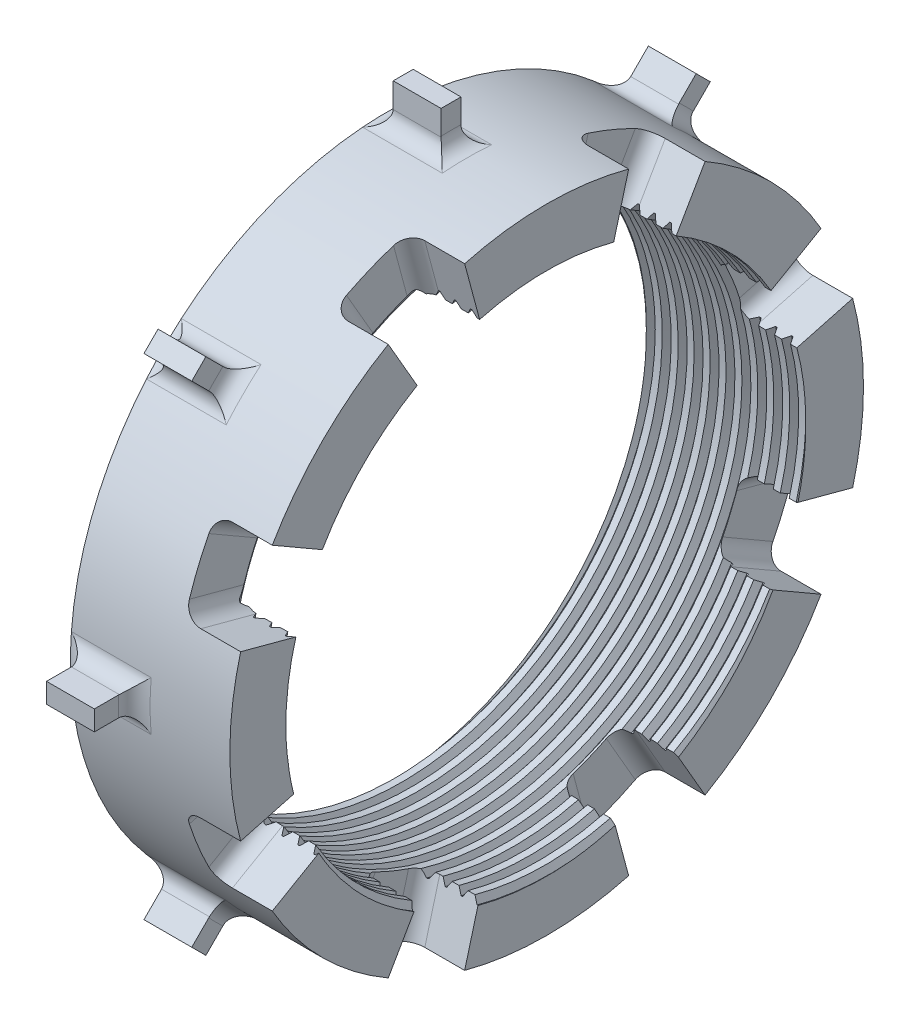
from build123d import *

# Parameters (mm, degrees)
SKETCH1_R                = 39.75
SKETCH1_R_2              = 32.5
BOSS_EXTRUDE1_DEPTH      = 20
BOSS_EXTRUDE2_START      = -6
BOSS_EXTRUDE2_DEPTH      = 6
CIRPATTERN1_COUNT        = 8
FILLET1_R                = 2
CUT_EXTRUDE2_START       = -7
CUT_EXTRUDE2_DEPTH       = 7
FILLET2_R                = 2
CIRPATTERN2_COUNT        = 8
FILLET2_OF_CIRPATTERN2_R = 2
THREAD1_PITCH            = 2


with BuildPart() as part:
    # Sketch1 → Boss-Extrude1 (new body)
    with BuildSketch(Plane(origin=(0, 0, 0), x_dir=(0, 0, -1), z_dir=(1, 0, 0))):
        Circle(SKETCH1_R)
        Circle(SKETCH1_R_2, mode=Mode.SUBTRACT)
    extrude(amount=BOSS_EXTRUDE1_DEPTH)

    # Sketch2 → Boss-Extrude2 (add)
    with BuildSketch(Plane(origin=(8, 0, 0), x_dir=(0, 0, -1), z_dir=(1, 0, 0)).offset(BOSS_EXTRUDE2_START)):
        with BuildLine():
            Line((39.730341051, 1.25), (44.75, 1.25))
            Line((44.75, 1.25), (44.75, -1.25))
            Line((44.75, -1.25), (39.730341051, -1.25))
            ThreePointArc((39.730341051, -1.25), (39.75, 0), (39.730341051, 1.25))
        make_face()
    boss_extrude2 = extrude(amount=BOSS_EXTRUDE2_DEPTH)

    # CirPattern1: Boss-Extrude2 ×8 about axis
    cirpattern1_axis = Axis((0, 0, 0), (1, 0, 0))
    for i in range(1, CIRPATTERN1_COUNT):
        add(boss_extrude2.rotate(cirpattern1_axis, i * 360 / CIRPATTERN1_COUNT))

    # Fillet1
    fillet1_edges = [part.edges().sort_by_distance(p)[0] for p in [
        (8, -0.62507729, -39.745084959),
        (5, -1.25, -39.730341051),
        (5, 1.25, -39.730341051),
        (2, -0.62507729, -39.745084959),
        (8, -28.107494552, -28.107494552),
        (5, -28.977477052, -27.209710099),
        (5, -27.209710099, -28.977477052),
        (2, -28.107494552, -28.107494552),
        (8, -39.75, 0),
        (5, -39.730341051, 1.25),
        (5, -39.730341051, -1.25),
        (2, -39.75, 0),
        (8, -28.107494552, 28.107494552),
        (5, -27.209710099, 28.977477052),
        (5, -28.977477052, 27.209710099),
        (2, -28.107494552, 28.107494552),
        (8, 0, 39.75),
        (5, 1.25, 39.730341051),
        (5, -1.25, 39.730341051),
        (2, 0, 39.75),
        (8, 28.107494552, 28.107494552),
        (5, 28.977477052, 27.209710099),
        (5, 27.209710099, 28.977477052),
        (2, 28.107494552, 28.107494552),
        (8, 39.75, 0),
        (5, 39.730341051, -1.25),
        (5, 39.730341051, 1.25),
        (2, 39.75, 0),
        (8, 28.107494552, -28.107494552),
        (5, 27.209710099, -28.977477052),
        (5, 28.977477052, -27.209710099),
        (2, 28.107494552, -28.107494552),
    ]]
    fillet(fillet1_edges, radius=FILLET1_R - 0.0001)  # a hair under: the kernel refuses the full size

    # Sketch3 → Cut-Extrude2 (cut)
    with BuildSketch(Plane(origin=(20, 0, 0), x_dir=(0, 0, -1), z_dir=(1, 0, 0)).offset(CUT_EXTRUDE2_START)):
        with BuildLine():
            Line((38.395551595, -10.288057043), (0, 0))
            Line((0, 0), (36.724211417, -15.211666437))
            ThreePointArc((36.724211417, -15.211666437), (37.640472647, -12.777218746), (38.395551595, -10.288057043))
        make_face()
        with BuildLine():
            Line((36.724211417, -15.211666437), (0, 0))
            Line((0, 0), (34.4245098, -19.875))
            ThreePointArc((34.4245098, -19.875), (35.650691476, -17.580975436), (36.724211417, -15.211666437))
        make_face()
    cut_extrude2 = extrude(amount=CUT_EXTRUDE2_DEPTH, mode=Mode.SUBTRACT)

    # Fillet2
    fillet2_edges = [part.edges().sort_by_distance(p)[0] for p in [
        (13, -18.0625, -31.285167712),
        (13, -9.349838004, -34.894070475),
    ]]
    fillet(fillet2_edges, radius=FILLET2_R)

    # CirPattern2: Cut-Extrude2 ×8 about axis
    cirpattern2_axis = Axis((0, 0, 0), (1, 0, 0))
    for i in range(1, CIRPATTERN2_COUNT):
        add(cut_extrude2.rotate(cirpattern2_axis, i * 360 / CIRPATTERN2_COUNT), mode=Mode.SUBTRACT)

    # Fillet2 of CirPattern2
    fillet2_of_cirpattern2_edges = [part.edges().sort_by_distance(p)[0] for p in [
        (13, 9.349838004, -34.894070475),
        (13, 18.0625, -31.285167712),
        (13, 31.285167712, -18.0625),
        (13, 34.894070475, -9.349838004),
        (13, 34.894070475, 9.349838004),
        (13, 31.285167712, 18.0625),
        (13, 18.0625, 31.285167712),
        (13, 9.349838004, 34.894070475),
        (13, -9.349838004, 34.894070475),
        (13, -18.0625, 31.285167712),
        (13, -31.285167712, 18.0625),
        (13, -34.894070475, 9.349838004),
        (13, -34.894070475, -9.349838004),
        (13, -31.285167712, -18.0625),
    ]]
    fillet(fillet2_of_cirpattern2_edges, radius=FILLET2_OF_CIRPATTERN2_R)

    # Thread1: the profile of Thread Profile2 profile screwed along a right-hand helix of 12.5 turns, 10 arcs to a turn; built about Z, then put on its axis
    thread1_z = Axis((0, 0, 0), (0, 0, 1))
    thread1_corners = [(32.4997, 0, -0.000173205), (33.311898812, 0, 0.468749998), (33.311898812, 0, 0.656249998), (32.4997, 0, 1.125173201)]
    with BuildLine(mode=Mode.PRIVATE) as thread1_profile:
        Line(thread1_corners[0], thread1_corners[1])
        Line(thread1_corners[1], thread1_corners[2])
        Line(thread1_corners[2], thread1_corners[3])
        Line(thread1_corners[3], thread1_corners[0])
    thread1_cap = Face(thread1_profile.wire())
    thread1_turn_angles = [0, 18, 36, 54, 72, 90, 108, 126, 144, 162, 180, 198, 216, 234, 252, 270, 288, 306, 324, 342, 360]
    thread1_turn_weights = [1, 0.9510565162951535, 1, 0.9510565162951535, 1, 0.9510565162951535, 1, 0.9510565162951535, 1, 0.9510565162951535, 1, 0.9510565162951535, 1, 0.9510565162951535, 1, 0.9510565162951535, 1, 0.9510565162951535, 1, 0.9510565162951535, 1]
    thread1_turn_rails = [Edge.make_bspline([Vector(p[0], p[1], 0).rotate(thread1_z, thread1_turn_angles[k]) / thread1_turn_weights[k] + Vector(0, 0, p[2] + THREAD1_PITCH * thread1_turn_angles[k] / 360) for k in range(21)], [0, 0, 0, 1, 1, 2, 2, 3, 3, 4, 4, 5, 5, 6, 6, 7, 7, 8, 8, 9, 9, 10, 10, 10], 2, thread1_turn_weights) for p in thread1_corners]
    thread1_turn_sides = [Face.make_surface_from_curves(thread1_turn_rails[p[0]], thread1_turn_rails[p[1]]) for p in [(0, 1), (1, 2), (2, 3), (3, 0)]]
    thread1_last_angles = [4320, 4338, 4356, 4374, 4392, 4410, 4428, 4446, 4464, 4482, 4500]
    thread1_last_weights = [1, 0.9510565162951535, 1, 0.9510565162951535, 1, 0.9510565162951535, 1, 0.9510565162951535, 1, 0.9510565162951535, 1]
    thread1_last_rails = [Edge.make_bspline([Vector(p[0], p[1], 0).rotate(thread1_z, thread1_last_angles[k]) / thread1_last_weights[k] + Vector(0, 0, p[2] + THREAD1_PITCH * thread1_last_angles[k] / 360) for k in range(11)], [0, 0, 0, 1, 1, 2, 2, 3, 3, 4, 4, 5, 5, 5], 2, thread1_last_weights) for p in thread1_corners]
    thread1_last_sides = [Face.make_surface_from_curves(thread1_last_rails[p[0]], thread1_last_rails[p[1]]) for p in [(0, 1), (1, 2), (2, 3), (3, 0)]]
    thread1 = Plane(origin=(-2, 0, 0), x_dir=(0, 0, -1), z_dir=(1, 0, 0)) * Solid(Shell([*[p.moved(Location((0, 0, THREAD1_PITCH * i))) for i in range(12) for p in thread1_turn_sides], *thread1_last_sides, thread1_cap, thread1_cap.rotate(thread1_z, 4500).moved(Location((0, 0, THREAD1_PITCH * 4500 / 360)))]))
    add(thread1, mode=Mode.SUBTRACT)


solid = part.part
